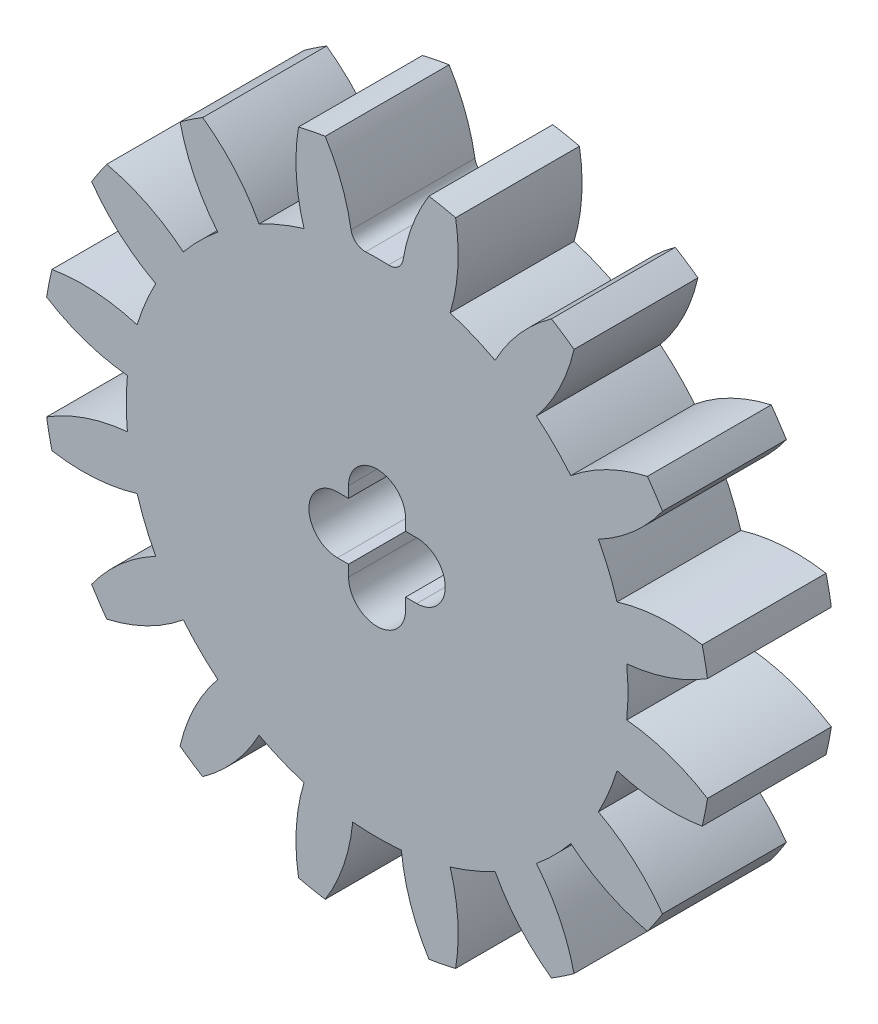
from build123d import *

# Parameters (mm, degrees)
SKETCH1_R           = 13.5
BOSS_EXTRUDE1_DEPTH = 2.5
CUT_EXTRUDE1_DEPTH  = 20.254869514
FILLET1_R           = 0.57
CIRPATTERN3_COUNT   = 16


with BuildPart() as part:
    # Sketch1 → Boss-Extrude1 (new, symmetric)
    with BuildSketch(Plane.XY):
        Circle(SKETCH1_R)
        with BuildLine():
            ThreePointArc((1.15, -1.6), (0, -2.75), (-1.15, -1.6))
            Line((-1.15, -1.6), (-1.15, -1.15))
            Line((-1.15, -1.15), (-1.6, -1.15))
            ThreePointArc((-1.6, -1.15), (-2.75, 0), (-1.6, 1.15))
            Line((-1.6, 1.15), (-1.15, 1.15))
            Line((-1.15, 1.15), (-1.15, 1.6))
            ThreePointArc((-1.15, 1.6), (0, 2.75), (1.15, 1.6))
            Line((1.15, 1.6), (1.15, 1.15))
            Line((1.15, 1.15), (1.6, 1.15))
            ThreePointArc((1.6, 1.15), (2.75, 0), (1.6, -1.15))
            Line((1.6, -1.15), (1.15, -1.15))
            Line((1.15, -1.15), (1.15, -1.6))
        make_face(mode=Mode.SUBTRACT)
    extrude(amount=BOSS_EXTRUDE1_DEPTH, both=True)

    # Sketch2 → Cut-Extrude1 (cut, symmetric)
    with BuildSketch(Plane.XY):
        with BuildLine():
            ThreePointArc((0.982234387, 10.077243701), (0, 10.125), (-0.982234387, 10.077243701))
            ThreePointArc((-0.982234387, 10.077243701), (-1.348268622, 11.771504161), (-2.092826994, 13.336794037))
            ThreePointArc((-2.092826994, 13.336794037), (0, 13.5), (2.092826994, 13.336794037))
            ThreePointArc((2.092826994, 13.336794037), (1.348268622, 11.771504161), (0.982234387, 10.077243701))
        make_face()
    cut_extrude1 = extrude(amount=CUT_EXTRUDE1_DEPTH, both=True, mode=Mode.SUBTRACT)

    # Fillet1
    fillet1_edges = [part.edges().sort_by_distance(p)[0] for p in [
        (0.982234387, 10.077243701, 0),
        (-0.982234387, 10.077243701, 0),
    ]]
    fillet(fillet1_edges, radius=FILLET1_R)

    # CirPattern3: Cut-Extrude1 ×16 about axis
    cirpattern3_axis = Axis((0, 0, 2.5), (0, 0, -1))
    for i in range(1, CIRPATTERN3_COUNT):
        add(cut_extrude1.rotate(cirpattern3_axis, i * 360 / CIRPATTERN3_COUNT), mode=Mode.SUBTRACT)


solid = part.part
